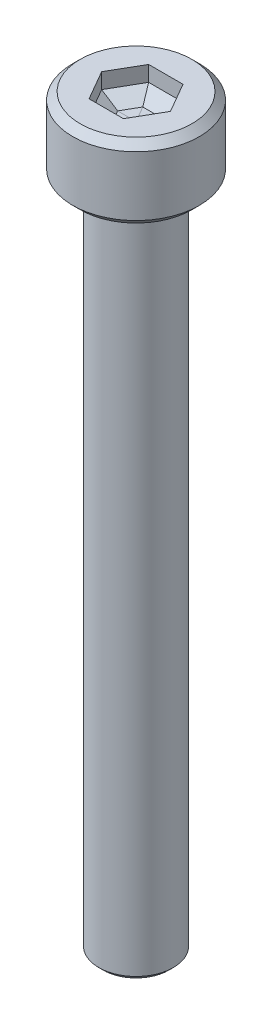
from build123d import *

# Parameters (mm, degrees)
REDONDEO1_R          = 0.2
CHAFL_N1_SIZE        = 0.3
CHAFL_N2_SIZE        = 0.5
CORTAR_BARRER1_START = 3.956316317
CORTAR_BARRER1_DEPTH = 1.043683683


with BuildPart() as part:
    # Croquis1 → Revolución1 (revolve)
    with BuildSketch(Plane.XY):
        Polygon((0, 0), (0, -45), (2.5, -45), (2.5, 0), (4.25, 0), (4.25, 5), (0, 5), align=None)
    revolve(axis=Axis((0, -1001.198752701, 0), (0, 1, 0)))

    # Redondeo1
    redondeo1_edges = [part.edges().sort_by_distance(p)[0] for p in [
        (-2.5, 0, 0),
    ]]
    fillet(redondeo1_edges, radius=REDONDEO1_R)

    # Chaflán1
    chafl_n1_edges = [part.edges().sort_by_distance(p)[0] for p in [
        (-2.5, -45, 0),
    ]]
    chamfer(chafl_n1_edges, length=CHAFL_N1_SIZE)

    # Chaflán2
    chafl_n2_edges = [part.edges().sort_by_distance(p)[0] for p in [
        (-4.25, 5, 0),
        (-4.25, 0, 0),
    ]]
    chamfer(chafl_n2_edges, length=CHAFL_N2_SIZE)

    # Cortar-Barrer1: read off the stored shape, not the designer's step
    # Cortar-Barrer1 outline → Cortar-Barrer1 (cut)
    with BuildSketch(Plane(origin=(0, 0, 0), x_dir=(1, 0, 0), z_dir=(0, 1, 0)).offset(CORTAR_BARRER1_START)):
        Polygon((1.154700538, 2), (-1.154700538, 2), (-2.309401077, 0), (-1.154700538, -2), (1.154700538, -2), (2.309401077, 0), align=None)
    extrude(amount=CORTAR_BARRER1_DEPTH, mode=Mode.SUBTRACT)

    # Cortar-Barrer1 2: loft between two sections, ruled curve by curve
    cortar_barrer1_2_from = [
        Edge.make_line((-2.309401077, 3.956316317, 0), (-1.154700538, 3.956316317, -2)),
        Edge.make_line((-1.154700538, 3.956316317, 2), (-2.309401077, 3.956316317, 0)),
        Edge.make_line((-1.154700538, 3.956316317, -2), (1.154700538, 3.956316317, -2)),
        Edge.make_line((1.154700538, 3.956316317, 2), (-1.154700538, 3.956316317, 2)),
        Edge.make_line((1.154700538, 3.956316317, -2), (2.309401077, 3.956316317, 0)),
        Edge.make_line((2.309401077, 3.956316317, 0), (1.154700538, 3.956316317, 2)),
    ]
    cortar_barrer1_2_to = [
        Edge.make_line((-1.235376897, 3.257522104, 0), (-0.617688448, 3.257522104, -1.069867776)),
        Edge.make_line((-0.617688448, 3.257522104, 1.069867776), (-1.235376897, 3.257522104, 0)),
        Edge.make_line((-0.617688448, 3.257522104, -1.069867776), (0.617688448, 3.257522104, -1.069867776)),
        Edge.make_line((0.617688448, 3.257522104, 1.069867776), (-0.617688448, 3.257522104, 1.069867776)),
        Edge.make_line((0.617688448, 3.257522104, -1.069867776), (1.235376897, 3.257522104, 0)),
        Edge.make_line((1.235376897, 3.257522104, 0), (0.617688448, 3.257522104, 1.069867776)),
    ]
    cortar_barrer1_2 = Solid(Shell([*[Face.make_surface_from_curves(cortar_barrer1_2_from[k], cortar_barrer1_2_to[k]) for k in range(6)], Face(Wire(cortar_barrer1_2_from)), Face(Wire(cortar_barrer1_2_to))]))
    add(cortar_barrer1_2, mode=Mode.SUBTRACT)


solid = part.part
